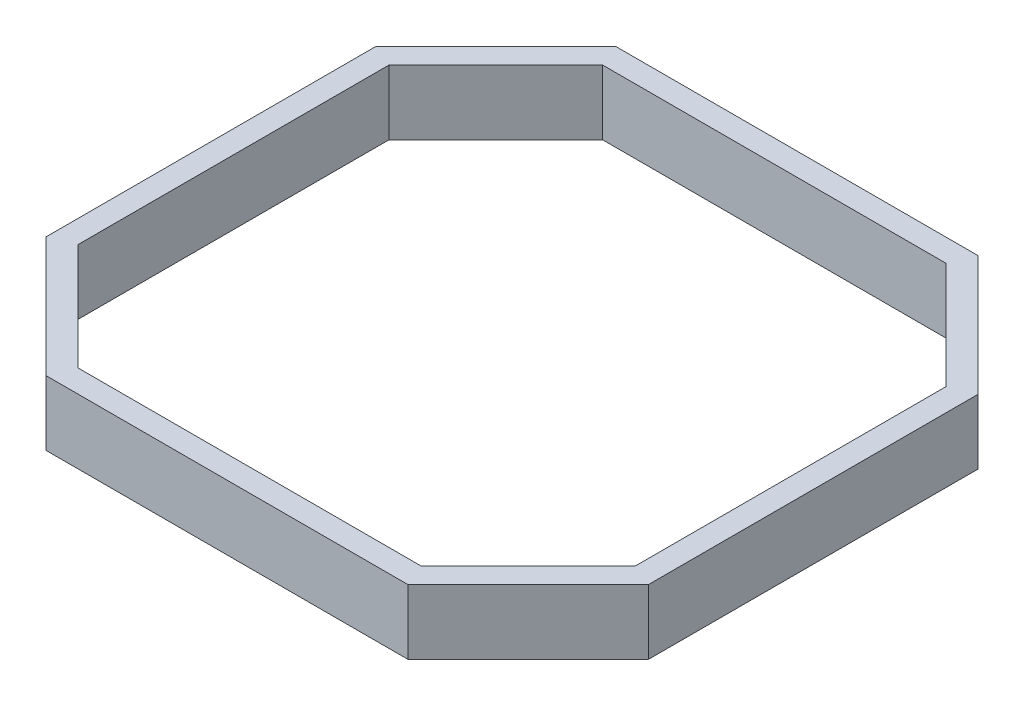
from build123d import *

# Parameters (mm, degrees)
BOSS_EXTRUDE1_DEPTH = 10


with BuildPart() as part:
    # Sketch1 → Boss-Extrude1 (new body)
    with BuildSketch(Plane(origin=(0, 0, 0), x_dir=(1, 0, 0), z_dir=(0, 1, 0))):
        Polygon((-46.5, 25.449747468), (-27.949747468, 44), (27.949747468, 44), (46.5, 25.449747468), (46.5, -25.449747468), (27.949747468, -44), (-27.949747468, -44), (-46.5, -25.449747468), align=None)
        Polygon((-43, 24), (-26.5, 40.5), (26.5, 40.5), (43, 24), (43, -24), (26.5, -40.5), (-26.5, -40.5), (-43, -24), align=None, mode=Mode.SUBTRACT)
    extrude(amount=BOSS_EXTRUDE1_DEPTH)


solid = part.part
